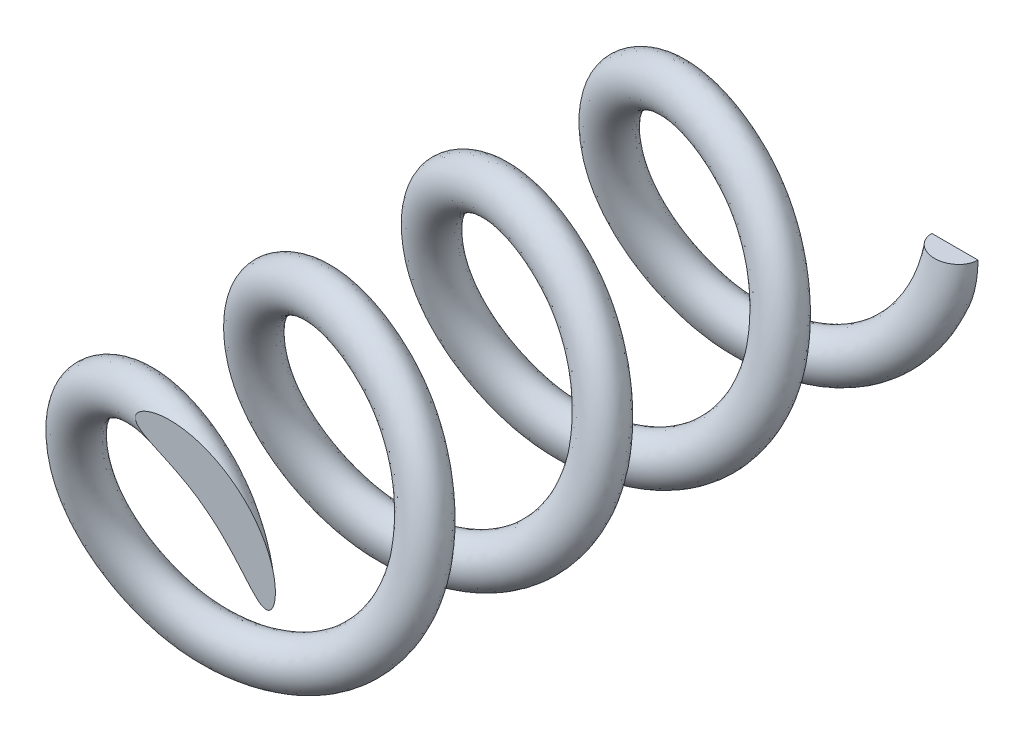
from build123d import *

# Parameters (mm, degrees)
SWEEP1_PITCH            = 3.5
CUT_EXTRUDE2_DEPTH      = 15.862032294
CUT_EXTRUDE2_DEPTH_BACK = 15.862032294
SKETCH5_W               = 5.652790382
SKETCH5_H               = 1.27
SKETCH5_W_2             = 5.362932004
SKETCH5_H_2             = 1.268364766
SCALE1_SCALE_X          = 1
SCALE1_SCALE_Y          = 1
SCALE1_SCALE_Z          = 0.88


with BuildPart() as part:
    # Sweep1: the profile of Sketch2 screwed along a left-hand helix of 4 turns, 6 arcs to a turn; built about Z, then put on its axis
    sweep1_z = Axis((0, 0, 0), (0, 0, 1))
    sweep1_corners = [(2.6, 0, 0), (2.2, 0, -0.4), (1.8, 0, 0), (2.2, 0, 0.4)]
    with BuildLine(mode=Mode.PRIVATE) as sweep1_profile:
        ThreePointArc((2.6, 0, 0), (2.482842712, 0, -0.282842712), (2.2, 0, -0.4))
        ThreePointArc((2.2, 0, -0.4), (1.917157288, 0, -0.282842712), (1.8, 0, 0))
        ThreePointArc((1.8, 0, 0), (1.917157288, 0, 0.282842712), (2.2, 0, 0.4))
        ThreePointArc((2.2, 0, 0.4), (2.482842712, 0, 0.282842712), (2.6, 0, 0))
    sweep1_cap = Face(sweep1_profile.wire())
    sweep1_arcs = [((2.6, 0, 0), (2.6, 0, -0.4), (2.2, 0, -0.4), (1, 0.7071067811865475, 1)), ((2.2, 0, -0.4), (1.8, 0, -0.4), (1.8, 0, 0), (1, 0.7071067811865475, 1)), ((1.8, 0, 0), (1.8, 0, 0.4), (2.2, 0, 0.4), (1, 0.7071067811865475, 1)), ((2.2, 0, 0.4), (2.6, 0, 0.4), (2.6, 0, 0), (1, 0.7071067811865475, 1))]  # start, shoulder, end, weights
    sweep1_turn_angles = [0, -30, -60, -90, -120, -150, -180, -210, -240, -270, -300, -330, -360]
    sweep1_turn_weights = [1, 0.8660254037844387, 1, 0.8660254037844387, 1, 0.8660254037844387, 1, 0.8660254037844387, 1, 0.8660254037844387, 1, 0.8660254037844387, 1]
    sweep1_turn_sides = [Face.make_bezier_surface([[Vector(p[j][0], p[j][1], 0).rotate(sweep1_z, sweep1_turn_angles[2 * i + k]) / sweep1_turn_weights[2 * i + k] + Vector(0, 0, p[j][2] + -SWEEP1_PITCH * sweep1_turn_angles[2 * i + k] / 360) for k in range(3)] for j in range(3)], [[p[3][j] * sweep1_turn_weights[2 * i + k] for k in range(3)] for j in range(3)]) for p in sweep1_arcs for i in range(6)]
    sweep1 = Plane(origin=(0, 0, 0), x_dir=(1, 0, 0), z_dir=(0, 0, 1)) * Solid(Shell([*[p.moved(Location((0, 0, SWEEP1_PITCH * i))) for i in range(4) for p in sweep1_turn_sides], sweep1_cap, sweep1_cap.rotate(sweep1_z, -1440).moved(Location((0, 0, -SWEEP1_PITCH * -1440 / 360)))]))
    add(sweep1)

    # Sketch5 → Cut-Extrude2 (cut, two sides: drawn at the far end of the back side and taken through both)
    with BuildSketch(Plane(origin=(0, 0, 0), x_dir=(-1, 0, 0), z_dir=(0, 1, 0)).offset(-CUT_EXTRUDE2_DEPTH_BACK)):
        with Locations((-0.476895191, -0.635)):
            Rectangle(SKETCH5_W, SKETCH5_H)
        with Locations((-0.331966002, 14.122912001)):
            Rectangle(SKETCH5_W_2, SKETCH5_H_2)
    extrude(amount=CUT_EXTRUDE2_DEPTH + CUT_EXTRUDE2_DEPTH_BACK, mode=Mode.SUBTRACT)


with BuildPart() as part_1:
    # Scale1: scaled about (-0.082350404, -0.036814306, 6.786848943)
    add(part.part.scale((SCALE1_SCALE_X, SCALE1_SCALE_Y, SCALE1_SCALE_Z), about=(-0.082350404, -0.036814306, 6.786848943)))


solid = part_1.part
